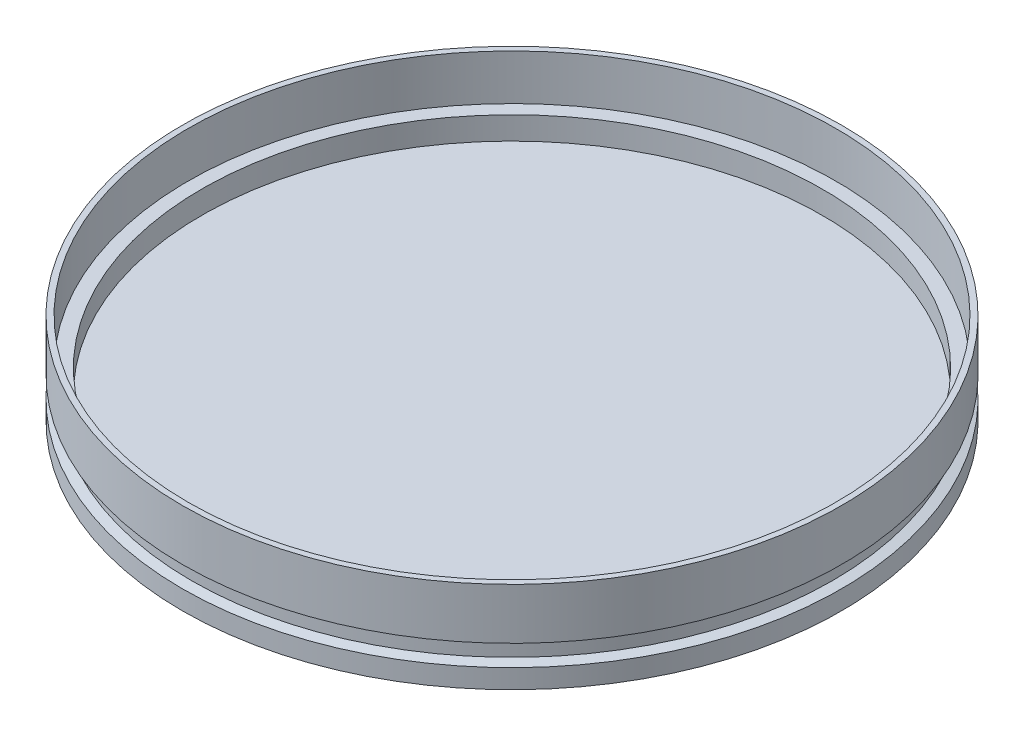
from build123d import *

# Parameters (mm, degrees)
SKETCH_1_R       = 72.25
SKETCH_1_R_2     = 71
EXTRUDE_1_DEPTH  = 20
SKETCH_1_6_R     = 71
SKETCH_1_6_R_2   = 68
EXTRUDE_3_DEPTH  = 10
SKETCH_2_W       = 2
SKETCH_2_H       = 3
CHAMFER_1_SIZE   = 3
CHAMFER_1_SIZE_2 = 0.803847577
CHAMFER_2_SIZE   = 0.803847577
CHAMFER_2_SIZE_2 = 3
SKETCH_1_8_R     = 68
SKETCH_1_8_R_2   = 62.25
EXTRUDE_5_DEPTH  = 5


with BuildPart() as part:
    # 草圖1 → 填料-伸長1 (new body)
    with BuildSketch(Plane(origin=(0, 0, 0), x_dir=(1, 0, 0), z_dir=(0, 1, 0))):
        with Locations(Location((0, 0, 0), (0, 0, 270))):
            Circle(SKETCH_1_R)
        with Locations(Location((0, 0, 0), (0, 0, 270))):
            Circle(SKETCH_1_R_2, mode=Mode.SUBTRACT)
    extrude(amount=EXTRUDE_1_DEPTH)

    # 草圖1<6> → 填料-伸長3 (add)
    with BuildSketch(Plane(origin=(0, 0, 0), x_dir=(1, 0, 0), z_dir=(0, 1, 0))):
        with Locations(Location((0, 0, 0), (0, 0, 270))):
            Circle(SKETCH_1_6_R)
        with Locations(Location((0, 0, 0), (0, 0, 270))):
            Circle(SKETCH_1_6_R_2, mode=Mode.SUBTRACT)
    extrude(amount=EXTRUDE_3_DEPTH)

    # 草圖2 → 除料-旋轉1 (revolve, cut)
    with BuildSketch(Plane.XY, mode=Mode.PRIVATE) as cut_revolve_1_sk:
        with Locations((71.25, 6.5)):
            Rectangle(SKETCH_2_W, SKETCH_2_H)
    revolve(cut_revolve_1_sk.sketch.rotate(Axis((0, 0, 0), (0, 1, 0)), 90), axis=Axis((0, 0, 0), (0, 1, 0)), mode=Mode.SUBTRACT)

    # 導角1
    # the kernel refuses this chamfer: 3, 0.803847577 mm, written as the material it takes off along each edge
    with BuildSketch(Plane(origin=(0, 8, 0), x_dir=(0, 0, 1), z_dir=(1, 0, 0))) as chamfer_1_piece_1_section:
        Polygon((72.25 - CHAMFER_1_SIZE, 0), (72.25, -CHAMFER_1_SIZE_2), (72.25, 0), align=None)
    chamfer_1_piece_1 = revolve(axis=Axis((0, 8, 0), (0, -1, 0)), mode=Mode.PRIVATE)
    chamfer_1_piece_1 = chamfer_1_piece_1 - Plane(origin=(0, 8.471650201, 0), x_dir=(0, 0, -1), z_dir=(0, 1, 0)) * Cylinder(70.25, 289, mode=Mode.PRIVATE)
    add(chamfer_1_piece_1, mode=Mode.SUBTRACT)

    # 導角2
    # the kernel refuses this chamfer: 3, 0.803847577 mm, written as the material it takes off along each edge
    with BuildSketch(Plane(origin=(0, 5, 0), x_dir=(0, 0, 1), z_dir=(1, 0, 0))) as chamfer_2_piece_1_section:
        Polygon((72.25, CHAMFER_2_SIZE), (72.25 - CHAMFER_2_SIZE_2, 0), (72.25, 0), align=None)
    chamfer_2_piece_1 = revolve(axis=Axis((0, 5, 0), (0, -1, 0)), mode=Mode.PRIVATE)
    chamfer_2_piece_1 = chamfer_2_piece_1 - Plane(origin=(0, 4.528349799, 0), x_dir=(0, 0, -1), z_dir=(0, 1, 0)) * Cylinder(70.25, 289, mode=Mode.PRIVATE)
    add(chamfer_2_piece_1, mode=Mode.SUBTRACT)

    # 草圖1<8> → 填料-伸長5 (add)
    # profile 1 of 2: a face of its own
    with BuildSketch(Plane(origin=(0, 0, 0), x_dir=(1, 0, 0), z_dir=(0, 1, 0))):
        with Locations(Location((0, 0, 0), (0, 0, 270))):
            Circle(SKETCH_1_8_R)
        Circle(SKETCH_1_8_R_2, mode=Mode.SUBTRACT)
    # profile 2 of 2: a face of its own
    with BuildSketch(Plane(origin=(0, 0, 0), x_dir=(1, 0, 0), z_dir=(0, 1, 0))):
        Circle(SKETCH_1_8_R_2)
    extrude(amount=EXTRUDE_5_DEPTH)


solid = part.part
